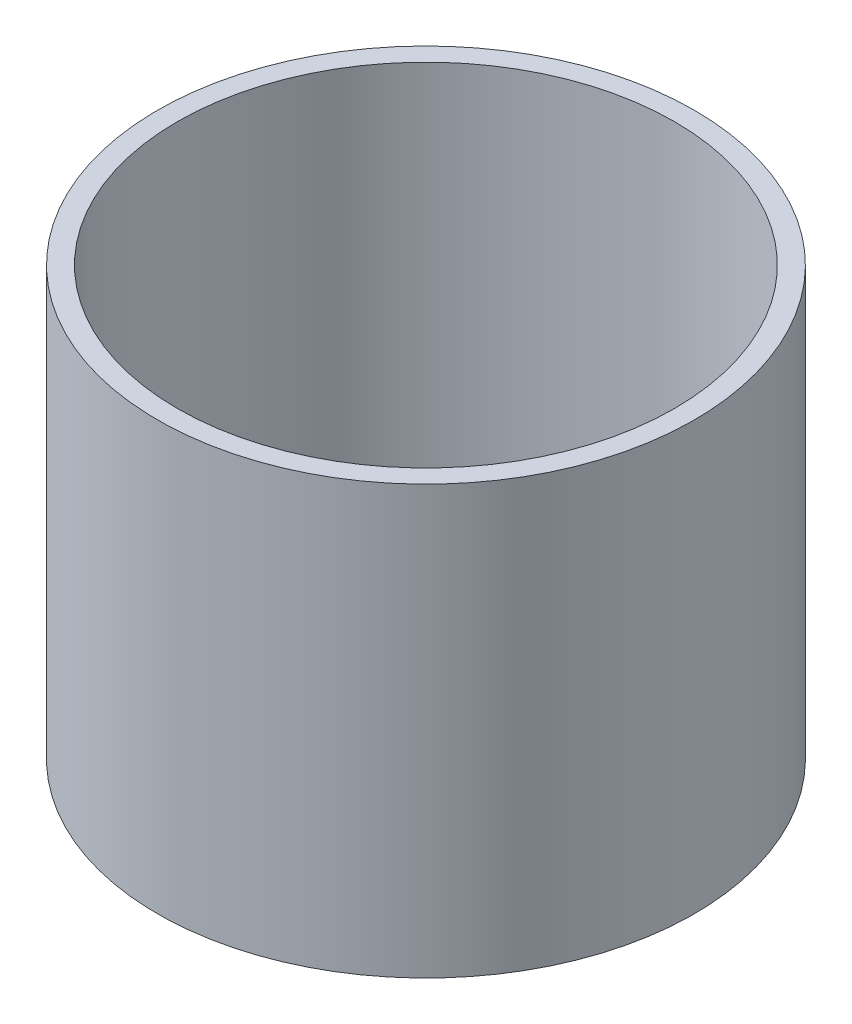
from build123d import *

# Parameters (mm, degrees)
SKETCH1_R             = 13.55
BOSS_EXTRUDE1_DEPTH   = 21.6
SHELL4_T              = -1
M2X0_4_TAPPED_HOLE1_D = 1.6
SKETCH4_R             = 4.35
BOSS_EXTRUDE2_DEPTH   = 1.5


with BuildPart() as part:
    # Sketch1 → Boss-Extrude1 (new body)
    with BuildSketch(Plane(origin=(0, 0, 0), x_dir=(1, 0, 0), z_dir=(0, 1, 0))):
        Circle(SKETCH1_R)
    extrude(amount=BOSS_EXTRUDE1_DEPTH)

    # Shell4
    shell4_openings = [part.faces().sort_by_distance(p)[0] for p in [
        (0, 21.6, 0),
    ]]
    offset(amount=SHELL4_T, openings=shell4_openings, kind=Kind.INTERSECTION)

    # M2x0.4 Tapped Hole1 (through all)
    with Locations(Plane(origin=(0, 21.6, 0), x_dir=(1, 0, 0), z_dir=(0, 1, 0))):
        with Locations((0, 6), (6, 0), (0, -6), (-6, 0)):
            Hole(M2X0_4_TAPPED_HOLE1_D / 2)

    # Sketch4 → Boss-Extrude2 (add)
    with BuildSketch(Plane.XZ):
        Circle(SKETCH4_R)
    extrude(amount=BOSS_EXTRUDE2_DEPTH)


solid = part.part
